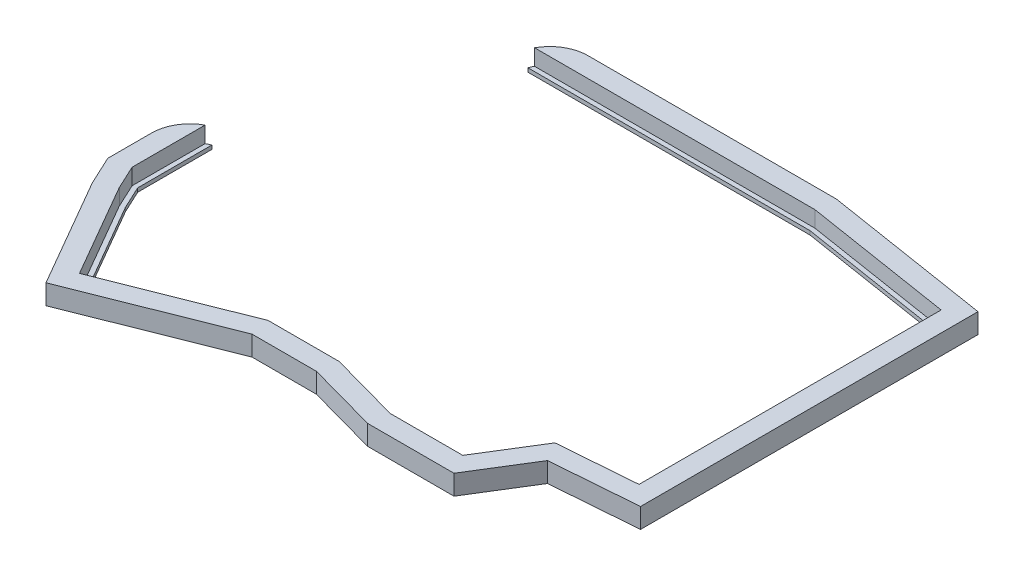
from build123d import *

# Parameters (mm, degrees)
BOSS_EXTRUDE1_DEPTH       = 1
BOSS_EXTRUDE2_DEPTH       = 5.2
CUTOUT_W                  = 25
CUTOUT_H                  = 60
CUT_EXTRUDE1_DEPTH        = 204.386455918
F_3_0MM_DOWEL_HOLE2_D     = 3.2
F_3_0MM_DOWEL_HOLE2_DEPTH = 1.2
FILLET1_START             = -1
FILLET1_DEPTH             = 7
FILLET2_START             = -1
FILLET2_DEPTH             = 7


with BuildPart() as part:
    # outline → Boss-Extrude1 (new body)
    with BuildSketch(Plane(origin=(0, 0, 0), x_dir=(1, 0, 0), z_dir=(0, 1, 0))):
        Polygon((160.788080985, 105.9953847), (121.597788595, 112.217917805), (22.752080985, 112.217917805), (22.752080985, 32.585832501), (25.688129691, 26.292829341), (39.910245267, 1.671913524), (75.213887712, 15.680109343), (93.764616437, 15.680109343), (112.21601573, 10.581860359), (131.186066133, 10.581860359), (140.397681326, 25.454275085), (160.788080985, 27.045655036), align=None)
        Polygon((121.503115121, 111.017917805), (23.952080985, 111.017917805), (23.952080985, 32.851995342), (26.753439113, 26.847682296), (40.43096447, 3.169545341), (74.984511229, 16.880109343), (93.927351675, 16.880109343), (112.378750968, 11.781860359), (130.517785359, 11.781860359), (139.697830253, 26.603303939), (159.588080985, 28.155649493), (159.588080985, 104.970885583), align=None, mode=Mode.SUBTRACT)
    extrude(amount=BOSS_EXTRUDE1_DEPTH)

    # outline<9> → Boss-Extrude2 (add)
    with BuildSketch(Plane(origin=(0, 0, 0), x_dir=(1, 0, 0), z_dir=(0, 1, 0))):
        Polygon((165.988080985, 110.434880876), (122.008040315, 117.417917805), (17.552080985, 117.417917805), (17.552080985, 31.432460189), (21.071788866, 23.888466533), (37.653795388, -4.817824349), (76.207852469, 10.480109343), (93.059430407, 10.480109343), (111.510829699, 5.381860359), (134.081949487, 5.381860359), (143.430369308, 20.475150048), (165.988080985, 22.235679058), align=None)
        Polygon((121.597788595, 112.217917805), (22.752080985, 112.217917805), (22.752080985, 32.585832501), (25.688129691, 26.292829341), (39.910245267, 1.671913524), (75.213887712, 15.680109343), (93.764616437, 15.680109343), (112.21601573, 10.581860359), (131.186066133, 10.581860359), (140.397681326, 25.454275085), (160.788080985, 27.045655036), (160.788080985, 105.9953847), align=None, mode=Mode.SUBTRACT)
    extrude(amount=BOSS_EXTRUDE2_DEPTH)

    # cutout → Cut-Extrude1 (cut, through all)
    with BuildSketch(Plane(origin=(0, 0, 0), x_dir=(1, 0, 0), z_dir=(0, 1, 0))):
        with Locations((35.252080985, 82.217917805)):
            Rectangle(CUTOUT_W, CUTOUT_H)
        Polygon((17.552080985, 117.417917805), (17.552080985, 52.217917805), (22.752080985, 52.217917805), (22.752080985, 112.217917805), (47.752080985, 112.217917805), (47.752080985, 117.417917805), align=None)
    extrude(amount=CUT_EXTRUDE1_DEPTH, mode=Mode.SUBTRACT)

    # Ø3.0mm Dowel Hole2
    with Locations(Plane.XZ):
        with Locations((84.67493479, -114.817917805), (20.152080985, -32.009146345), (38.782020327, 1.572955412), (75.710870091, -13.080109343), (111.863422715, -7.981860359), (163.388080985, -24.640667047), (163.388080985, -108.215132788), (121.802914455, -114.817917805)):
            Hole(F_3_0MM_DOWEL_HOLE2_D / 2, depth=F_3_0MM_DOWEL_HOLE2_DEPTH)

    # Fillet1: read off the stored shape, not the designer's step
    # Fillet1 outline → Fillet1 (cut)
    with BuildSketch(Plane(origin=(0, 0, 0), x_dir=(1, 0, 0), z_dir=(0, 1, 0)).offset(FILLET1_START)):
        with BuildLine():
            Line((47.752080985, 117.417917805), (47.752080985, 111.017917805))
            ThreePointArc((47.752080985, 111.017917805), (51.424749768, 115.664129056), (57.081604017, 117.417917805))
            Line((57.081604017, 117.417917805), (47.752080985, 117.417917805))
        make_face()
    extrude(amount=FILLET1_DEPTH, mode=Mode.SUBTRACT)

    # Fillet2: read off the stored shape, not the designer's step
    # Fillet2 outline → Fillet2 (cut)
    with BuildSketch(Plane(origin=(0, 0, 0), x_dir=(1, 0, 0), z_dir=(0, 1, 0)).offset(FILLET2_START)):
        with BuildLine():
            Line((17.552080985, 52.217917805), (17.552080985, 42.888394773))
            ThreePointArc((17.552080985, 42.888394773), (19.305869734, 48.545249023), (23.952080985, 52.217917805))
            Line((23.952080985, 52.217917805), (17.552080985, 52.217917805))
        make_face()
    extrude(amount=FILLET2_DEPTH, mode=Mode.SUBTRACT)


solid = part.part
